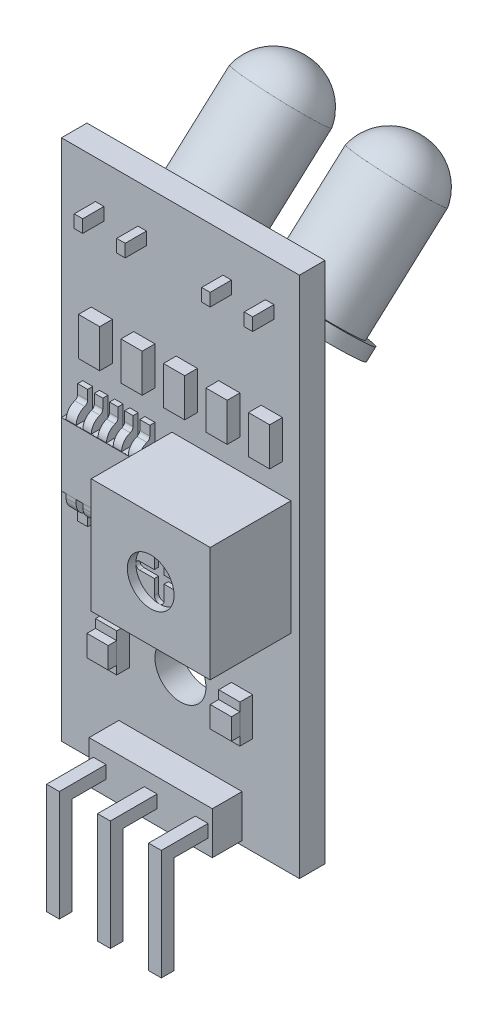
from build123d import *

# Parameters (mm, degrees)
SKETCH1_W                 = 14.224
SKETCH1_H                 = 31.242
BOSS_EXTRUDE1_DEPTH       = 0.762
SKETCH2_W                 = 7.366
SKETCH2_H                 = 2.54
BOSS_EXTRUDE2_DEPTH       = 1.778
BOSS_EXTRUDE3_START       = -4.318
SKETCH5_W                 = 0.762
SKETCH5_H                 = 0.762
BOSS_EXTRUDE3_DEPTH       = 6.35
SKETCH6_W                 = 0.762
SKETCH6_H                 = 0.762
BOSS_EXTRUDE4_DEPTH       = 6.604
LPATTERN1_COUNT           = 3
LPATTERN1_PITCH           = 3.048
CUT_EXTRUDE2_DEPTH        = 23.008773887
CUT_EXTRUDE2_DEPTH_BACK   = 23.008773887
SKETCH8_R                 = 1.524
SKETCH9_W                 = 1.27
SKETCH9_H                 = 2.286
BOSS_EXTRUDE5_DEPTH       = 0.762
SKETCH10_W                = 1.27
SKETCH10_H                = 1.27
BOSS_EXTRUDE6_DEPTH       = 0.508
LPATTERN2_START           = 3.048
LPATTERN2_OUTLINE_W       = 1.27
LPATTERN2_OUTLINE_H       = 0.508
LPATTERN2_DEPTH           = 1.27
LPATTERN2_START_2         = -9.779
LPATTERN2_2_OUTLINE_W     = 1.27
LPATTERN2_2_OUTLINE_H     = 0.762
LPATTERN2_2_DEPTH         = 2.286
SKETCH12_W                = 2.286
SKETCH12_H                = 1.27
BOSS_EXTRUDE7_DEPTH       = 0.762
LPATTERN3_COUNT           = 2
LPATTERN3_PITCH           = 5.842
SKETCH16_W                = 7.112
SKETCH16_H                = 6.858
BOSS_EXTRUDE9_DEPTH       = 4.826
SKETCH17_R                = 1.397
CUT_EXTRUDE3_DEPTH        = 0.508
CUT_EXTRUDE4_DEPTH        = 0.254
SKETCH19_W                = 1.27
SKETCH19_H                = 2.286
BOSS_EXTRUDE10_DEPTH      = 0.762
LPATTERN4_COUNT           = 5
LPATTERN4_PITCH           = 2.54
SKETCH31_W                = 4.826
SKETCH31_H                = 3.81
BOSS_EXTRUDE14_DEPTH      = 1.016
SKETCH32_W                = 4.318
SKETCH32_H                = 7.112
BOSS_EXTRUDE15_DEPTH      = 0.9906
SKETCH33_W                = 4.318
SKETCH33_H                = 0.762
CUT_EXTRUDE5_DEPTH        = 0.6858
FILLET4_R                 = 0.762
FILLET5_R                 = 0.254
BOSS_EXTRUDE16_START      = -2.54
SKETCH20_W                = 0.508
SKETCH20_H                = 0.762
BOSS_EXTRUDE16_DEPTH      = 3.81
LPATTERN6_COUNT           = 2
LPATTERN6_PITCH           = 2.54
LPATTERN9_COUNT           = 2
LPATTERN9_PITCH           = 7.62
LPATTERN9_START           = -2.54
LPATTERN9_COPY_1_SKETCH_W = 0.508
LPATTERN9_COPY_1_SKETCH_H = 0.762
LPATTERN9_COPY_1_DEPTH    = 3.81
CUT_EXTRUDE6_START        = -1.016
SKETCH38_W                = 0.4
SKETCH38_H                = 2.458537154
CUT_EXTRUDE6_DEPTH        = 0.9906
CUT_EXTRUDE7_DEPTH        = 37.168412861
CUT_EXTRUDE7_DEPTH_BACK   = 37.168412861
SKETCH39_W                = 10.668
SKETCH39_H                = 0.107837649
BODY_MOVE_COPY1_ANGLE     = 47.012859422


# Read off the part's stored shape, not the designer's step: LPattern2
with BuildPart() as part:
    # Sketch1 → Boss-Extrude1 (new, symmetric)
    with BuildSketch(Plane.XY):
        Rectangle(SKETCH1_W, SKETCH1_H)
    extrude(amount=BOSS_EXTRUDE1_DEPTH, both=True)

    # Sketch2 → Boss-Extrude2 (add)
    with BuildSketch(Plane.XY.offset(0.762)):
        with Locations((0, -14.097)):
            Rectangle(SKETCH2_W, SKETCH2_H)
    extrude(amount=BOSS_EXTRUDE2_DEPTH)

    # Sketch5 → Boss-Extrude3 (add)
    with BuildSketch(Plane.XY.offset(2.54).offset(BOSS_EXTRUDE3_START)):
        with Locations((-3.048, -14.097)):
            Rectangle(SKETCH5_W, SKETCH5_H)
    boss_extrude3 = extrude(amount=BOSS_EXTRUDE3_DEPTH)

    # Sketch6 → Boss-Extrude4 (add)
    with BuildSketch(Plane(origin=(0, -13.716, 0), x_dir=(1, 0, 0), z_dir=(0, 1, 0))):
        with Locations((-3.048, -4.953)):
            Rectangle(SKETCH6_W, SKETCH6_H)
    boss_extrude4 = extrude(amount=-BOSS_EXTRUDE4_DEPTH)

    # LPattern1: Boss-Extrude3, Boss-Extrude4 ×3
    with Locations(*[(i * LPATTERN1_PITCH, 0, 0) for i in range(1, LPATTERN1_COUNT)]):
        add(boss_extrude3)
        add(boss_extrude4)

    # Sketch8 → Cut-Extrude2 (cut, two sides: drawn at the far end of the back side and taken through both)
    with BuildSketch(Plane.XY.offset(0.762).offset(-CUT_EXTRUDE2_DEPTH_BACK)):
        with Locations(Location((0, -8.509, 0), (0, 0, 180))):
            Circle(SKETCH8_R)
    extrude(amount=CUT_EXTRUDE2_DEPTH + CUT_EXTRUDE2_DEPTH_BACK, mode=Mode.SUBTRACT)

    # Sketch9 → Boss-Extrude5 (add)
    with BuildSketch(Plane.XY.offset(0.762)):
        with Locations((-3.683, -8.636)):
            Rectangle(SKETCH9_W, SKETCH9_H)
    extrude(amount=BOSS_EXTRUDE5_DEPTH)

    # LPattern2 2 outline → LPattern2 2 (add)
    with BuildSketch(Plane(origin=(0, 0, 0), x_dir=(1, 0, 0), z_dir=(0, 1, 0)).offset(LPATTERN2_START_2)):
        with Locations((3.683, -1.143)):
            Rectangle(LPATTERN2_2_OUTLINE_W, LPATTERN2_2_OUTLINE_H)
    extrude(amount=LPATTERN2_2_DEPTH)

    # Sketch12 → Boss-Extrude7 (add)
    with BuildSketch(Plane.XY.offset(0.762)):
        with Locations((-2.921, -4.826)):
            Rectangle(SKETCH12_W, SKETCH12_H)
    boss_extrude7 = extrude(amount=BOSS_EXTRUDE7_DEPTH)

    # LPattern3: Boss-Extrude7 ×2
    with Locations(*[(i * LPATTERN3_PITCH, 0, 0) for i in range(1, LPATTERN3_COUNT)]):
        add(boss_extrude7)

    # Sketch16 → Boss-Extrude9 (add)
    with BuildSketch(Plane.XY.offset(0.762)):
        with Locations((3.048, 0.254)):
            Rectangle(SKETCH16_W, SKETCH16_H)
    extrude(amount=BOSS_EXTRUDE9_DEPTH)

    # Sketch17 → Cut-Extrude3 (cut)
    with BuildSketch(Plane.XY.offset(5.588)):
        with Locations((3.048, 0.127)):
            Circle(SKETCH17_R)
    extrude(amount=-CUT_EXTRUDE3_DEPTH, mode=Mode.SUBTRACT)

    # Sketch18 → Cut-Extrude4 (cut)
    with BuildSketch(Plane.XY.offset(5.08)):
        with BuildLine():
            Line((2.757000791, -0.979000791), (2.757000791, -0.102851416))
            Line((2.757000791, -0.102851416), (1.880851416, -0.102851416))
            ThreePointArc((1.880851416, -0.102851416), (1.651, 0.127), (1.880851416, 0.356851416))
            Line((1.880851416, 0.356851416), (2.757000791, 0.356851416))
            Line((2.757000791, 0.356851416), (2.757000791, 1.233000791))
            ThreePointArc((2.757000791, 1.233000791), (3.048, 1.524), (3.338999209, 1.233000791))
            Line((3.338999209, 1.233000791), (3.338999209, 0.356851416))
            Line((3.338999209, 0.356851416), (4.215148584, 0.356851416))
            ThreePointArc((4.215148584, 0.356851416), (4.445, 0.127), (4.215148584, -0.102851416))
            Line((4.215148584, -0.102851416), (3.338999209, -0.102851416))
            Line((3.338999209, -0.102851416), (3.338999209, -0.979000791))
            ThreePointArc((3.338999209, -0.979000791), (3.048, -1.27), (2.757000791, -0.979000791))
        make_face()
    extrude(amount=-CUT_EXTRUDE4_DEPTH, mode=Mode.SUBTRACT)

    # Sketch19 → Boss-Extrude10 (add)
    with BuildSketch(Plane.XY.offset(0.762)):
        with Locations((5.461, 6.604)):
            Rectangle(SKETCH19_W, SKETCH19_H)
    boss_extrude10 = extrude(amount=BOSS_EXTRUDE10_DEPTH)

    # LPattern4: Boss-Extrude10 ×5
    with Locations(*[(-i * LPATTERN4_PITCH, 0, 0) for i in range(1, LPATTERN4_COUNT)]):
        add(boss_extrude10)

    # Sketch31 → Boss-Extrude14 (add)
    with BuildSketch(Plane.XY.offset(0.762)):
        with Locations((-3.683, 0.254)):
            Rectangle(SKETCH31_W, SKETCH31_H)
    extrude(amount=BOSS_EXTRUDE14_DEPTH)

    # Sketch32 → Boss-Extrude15 (add)
    with BuildSketch(Plane.XY.offset(0.762)):
        with Locations((-3.683, 0.127)):
            Rectangle(SKETCH32_W, SKETCH32_H)
    extrude(amount=BOSS_EXTRUDE15_DEPTH)

    # Sketch33 → Cut-Extrude5 (cut)
    with BuildSketch(Plane.XY.offset(1.7526)):
        with Locations((-3.683, -3.048)):
            Rectangle(SKETCH33_W, SKETCH33_H)
        with Locations((-3.683, 3.302)):
            Rectangle(SKETCH33_W, SKETCH33_H)
    extrude(amount=-CUT_EXTRUDE5_DEPTH, mode=Mode.SUBTRACT)

    # Fillet4
    # the kernel refuses this fillet: 0.762 mm, written as the material it takes off along each edge
    with BuildSketch(Plane(origin=(0.371451068, 2.921, 1.7526), x_dir=(0, -1, 0), z_dir=(-1, 0, 0))) as fillet4_piece_1_section:
        with BuildLine():
            CenterArc((0.758180427, -0.762), FILLET4_R, 90, 84.260829523)
            Line((0, -0.6858), (0, 0))
            Line((0, 0), (0.758180427, 0))
        make_face()
    fillet4_piece_1 = extrude(amount=8.108902135, mode=Mode.PRIVATE)
    fillet4_piece_1 = split(fillet4_piece_1, bisect_by=Plane(origin=(-0.508, 2.675007043, 1.556844553), z_dir=(-1, 0, 0)), keep=Keep.TOP, mode=Mode.PRIVATE)
    add(fillet4_piece_1, mode=Mode.SUBTRACT)
    with BuildSketch(Plane(origin=(0.371451068, -2.667, 1.7526), x_dir=(0, 1, 0), z_dir=(-1, 0, 0))) as fillet4_piece_2_section:
        with BuildLine():
            CenterArc((0.758180427, 0.762), FILLET4_R, 185.739170477, 84.260829523)
            Line((0, 0.6858), (0, 0))
            Line((0, 0), (0.758180427, 0))
        make_face()
    fillet4_piece_2 = extrude(amount=8.108902135, mode=Mode.PRIVATE)
    fillet4_piece_2 = split(fillet4_piece_2, bisect_by=Plane(origin=(-0.508, -2.421007043, 1.556844553), z_dir=(-1, 0, 0)), keep=Keep.TOP, mode=Mode.PRIVATE)
    add(fillet4_piece_2, mode=Mode.SUBTRACT)

    # Fillet5
    fillet5_edges = [part.edges().sort_by_distance(p)[0] for p in [
        (-3.683, -2.667, 1.0668),
        (-3.683, 2.921, 1.0668),
    ]]
    fillet(fillet5_edges, radius=FILLET5_R)

    # Sketch20 → Boss-Extrude16 (add)
    with BuildSketch(Plane.XY.offset(0.762).offset(BOSS_EXTRUDE16_START)):
        with Locations((5.334, 12.954)):
            Rectangle(SKETCH20_W, SKETCH20_H)
    boss_extrude16 = extrude(amount=BOSS_EXTRUDE16_DEPTH)

    # LPattern6: Boss-Extrude16 ×2
    with Locations(*[(-i * LPATTERN6_PITCH, 0, 0) for i in range(1, LPATTERN6_COUNT)]):
        add(boss_extrude16)

    # Sketch37 → Revolve4 (revolve)
    with BuildSketch(Plane(origin=(0, 12.954, 0), x_dir=(1, 0, 0), z_dir=(0, 1, 0))):
        with BuildLine():
            Line((4.064, 1.778), (4.064, 11.176))
            ThreePointArc((4.064, 11.176), (5.701938499, 10.619923124), (6.604, 9.144))
            Line((6.604, 9.144), (6.604, 2.54))
            Line((6.604, 2.54), (7.112, 2.54))
            Line((7.112, 2.54), (7.112, 1.778))
            Line((7.112, 1.778), (4.064, 1.778))
        make_face()
    revolve4 = revolve(axis=Axis((4.064, 12.954, -1.778), (0, 0, -1)))

    # LPattern9: Boss-Extrude16, Revolve4 ×2
    with Locations(*[(-i * LPATTERN9_PITCH, 0, 0) for i in range(1, LPATTERN9_COUNT)]):
        add(boss_extrude16)
        add(revolve4)

    # LPattern9 copy 1 sketch → LPattern9 copy 1 (add)
    with BuildSketch(Plane(origin=(-10.16, 0, 0.762), x_dir=(1, 0, 0), z_dir=(0, 0, 1)).offset(LPATTERN9_START)):
        with Locations((5.334, 12.954)):
            Rectangle(LPATTERN9_COPY_1_SKETCH_W, LPATTERN9_COPY_1_SKETCH_H)
    extrude(amount=LPATTERN9_COPY_1_DEPTH)

    # Sketch38 → Cut-Extrude6 (cut)
    with BuildSketch(Plane.XY.offset(1.778).offset(CUT_EXTRUDE6_START)):
        with Locations((-5.042, 3.39208815)):
            Rectangle(SKETCH38_W, SKETCH38_H)
        with Locations((-2.324, -2.88408815)):
            Rectangle(SKETCH38_W, SKETCH38_H)
        with Locations((-4.136, 3.39208815)):
            Rectangle(SKETCH38_W, SKETCH38_H)
        with Locations((-3.23, 3.39208815)):
            Rectangle(SKETCH38_W, SKETCH38_H)
        with Locations((-2.324, 3.39208815)):
            Rectangle(SKETCH38_W, SKETCH38_H)
        with Locations((-3.23, -2.88408815)):
            Rectangle(SKETCH38_W, SKETCH38_H)
        with Locations((-4.136, -2.88408815)):
            Rectangle(SKETCH38_W, SKETCH38_H)
        with Locations((-5.042, -2.88408815)):
            Rectangle(SKETCH38_W, SKETCH38_H)
    extrude(amount=CUT_EXTRUDE6_DEPTH, mode=Mode.SUBTRACT)

    # Sketch39 → Cut-Extrude7 (cut, two sides: drawn at the far end of the back side and taken through both)
    with BuildSketch(Plane(origin=(0, 13.335, 0), x_dir=(1, 0, 0), z_dir=(0, 1, 0)).offset(-CUT_EXTRUDE7_DEPTH_BACK)):
        with Locations((0.254, 1.61407248)):
            Rectangle(SKETCH39_W, SKETCH39_H)
    extrude(amount=CUT_EXTRUDE7_DEPTH + CUT_EXTRUDE7_DEPTH_BACK, mode=Mode.SUBTRACT)


with BuildPart() as body_2:
    # Sketch10 → Boss-Extrude6 (new body)
    with BuildSketch(Plane.XY.offset(1.524)):
        with Locations((-3.683, -8.636)):
            Rectangle(SKETCH10_W, SKETCH10_H)
    extrude(amount=BOSS_EXTRUDE6_DEPTH)


with BuildPart() as body_3:
    # LPattern2 outline → LPattern2 (new body)
    with BuildSketch(Plane.YZ.offset(LPATTERN2_START)):
        with Locations((-8.636, 1.778)):
            Rectangle(LPATTERN2_OUTLINE_W, LPATTERN2_OUTLINE_H)
    extrude(amount=LPATTERN2_DEPTH)


with BuildPart() as cut_extrude7_piece_1:
    # of the separate pieces the step leaves, piece 1, a body of its own (cut_extrude7_pieces)
    add(part.part.solids().sort_by_distance((-5.08, 13.335, -1.560153655))[0])


with BuildPart() as cut_extrude7_piece_2:
    # of the separate pieces the step leaves, piece 2, a body of its own (cut_extrude7_pieces)
    add(part.part.solids().sort_by_distance((2.54, 13.335, -1.778))[0])


with BuildPart() as cut_extrude7_piece_3:
    # of the separate pieces the step leaves, piece 3, a body of its own (cut_extrude7_pieces)
    add(part.part.solids().sort_by_distance((-3.556, 12.954, -11.176))[0])


with BuildPart() as cut_extrude7_piece_4:
    # of the separate pieces the step leaves, piece 4, a body of its own (cut_extrude7_pieces)
    add(part.part.solids().sort_by_distance((-3.429, -13.716, -1.778))[0])


with BuildPart() as cut_extrude7_piece_5:
    # of the separate pieces the step leaves, piece 5, a body of its own (cut_extrude7_pieces)
    add(part.part.solids().sort_by_distance((-0.381, -13.716, -1.778))[0])


with BuildPart() as cut_extrude7_piece_6:
    # of the separate pieces the step leaves, piece 6, a body of its own (cut_extrude7_pieces)
    add(part.part.solids().sort_by_distance((2.667, -13.716, -1.778))[0])


with BuildPart() as cut_extrude7_piece_3_1:
    # Body-Move/Copy1: moved
    add(cut_extrude7_piece_3.part.moved(Location((0, 0, 0))).rotate(Axis((1.572641036, 12.82083279, -6.364680715), (0.9940019505364335, -0.10038248707523864, 0.04339906241332093)), BODY_MOVE_COPY1_ANGLE))


with BuildPart() as cut_extrude7_piece_2_1:
    # Body-Move/Copy1: moved
    add(cut_extrude7_piece_2.part.moved(Location((0, 0, 0))).rotate(Axis((1.572641036, 12.82083279, -6.364680715), (0.9940019505364335, -0.10038248707523864, 0.04339906241332093)), BODY_MOVE_COPY1_ANGLE))


solid = Compound([body_2.part, body_3.part, cut_extrude7_piece_1.part, cut_extrude7_piece_3_1.part, cut_extrude7_piece_2_1.part])
